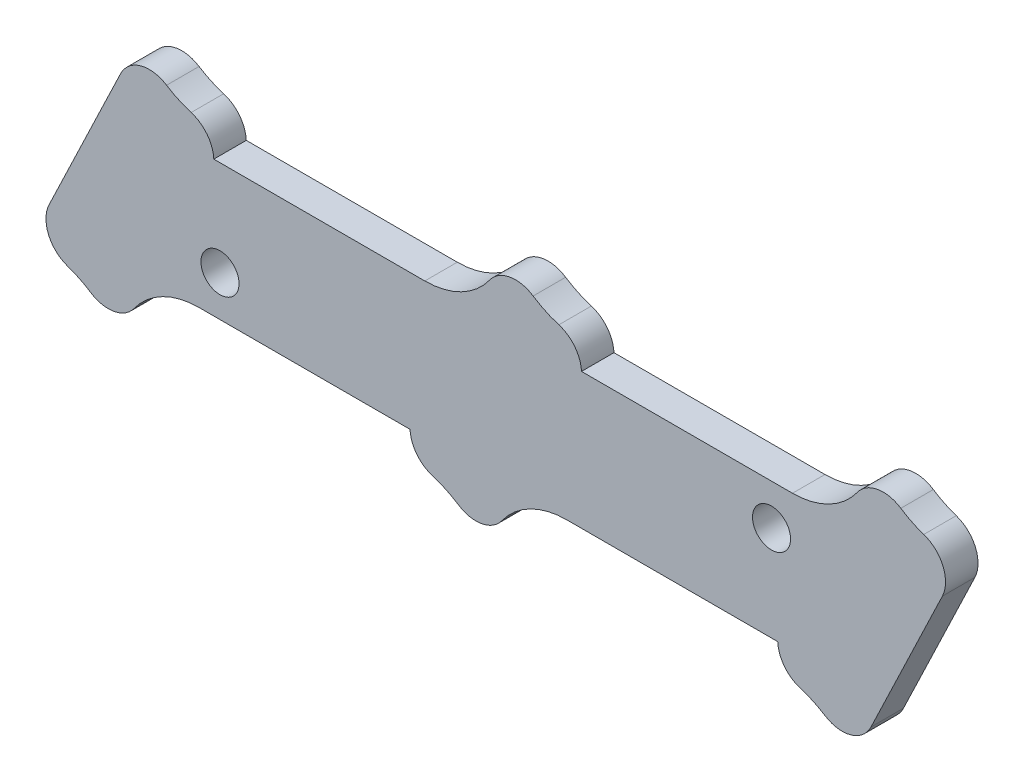
from build123d import *

# Parameters (mm, degrees)
BOSS_EXTRUDE1_DEPTH = 2.032
FILLET1_R           = 5
FILLET4_R           = 2
SKETCH5_R           = 1.190625
CUT_EXTRUDE1_DEPTH  = 75.011460165


with BuildPart() as part:
    # Sketch3 → Boss-Extrude1 (new body)
    with BuildSketch(Plane.XY):
        with BuildLine():
            Line((61.234837488, 27.025), (44.888079179, 27.025))
            Line((44.888079179, 27.025), (45.635822761, 28.585508346))
            ThreePointArc((45.635822761, 28.585508346), (42.595854881, 29.183740622), (40.224926589, 31.178229429))
            Line((40.224926589, 31.178229429), (38.234837488, 27.025))
            Line((38.234837488, 27.025), (21.888079179, 27.025))
            Line((21.888079179, 27.025), (22.635822761, 28.585508346))
            ThreePointArc((22.635822761, 28.585508346), (19.595854881, 29.183740622), (17.224926589, 31.178229429))
            Line((17.224926589, 31.178229429), (10.414177239, 16.964491654))
            ThreePointArc((10.414177239, 16.964491654), (13.454145119, 16.366259378), (15.825073411, 14.371770571))
            Line((15.825073411, 14.371770571), (17.815162512, 18.525))
            Line((17.815162512, 18.525), (34.161920821, 18.525))
            Line((34.161920821, 18.525), (33.414177239, 16.964491654))
            ThreePointArc((33.414177239, 16.964491654), (36.454145119, 16.366259378), (38.825073411, 14.371770571))
            Line((38.825073411, 14.371770571), (40.815162512, 18.525))
            Line((40.815162512, 18.525), (57.161920821, 18.525))
            Line((57.161920821, 18.525), (56.414177239, 16.964491654))
            ThreePointArc((56.414177239, 16.964491654), (59.454145119, 16.366259378), (61.825073411, 14.371770571))
            Line((61.825073411, 14.371770571), (68.635822761, 28.585508346))
            ThreePointArc((68.635822761, 28.585508346), (65.595854881, 29.183740622), (63.224926589, 31.178229429))
            Line((63.224926589, 31.178229429), (61.234837488, 27.025))
        make_face()
    extrude(amount=BOSS_EXTRUDE1_DEPTH)

    # Fillet1
    fillet1_edges = [part.edges().sort_by_distance(p)[0] for p in [
        (38.234837488, 27.025, 1.016),
        (61.234837488, 27.025, 1.016),
        (40.815162512, 18.525, 1.016),
        (17.815162512, 18.525, 1.016),
    ]]
    fillet(fillet1_edges, radius=FILLET1_R)

    # Fillet4
    # the kernel refuses this fillet: 2 mm, written as the material it takes off along each edge
    with BuildSketch(Plane(origin=(61.825073411, 14.371770571, -6.782329983), x_dir=(-0.7244869564055234, 0.6892885099856672, 0), z_dir=(0, 0, 1))) as fillet4_piece_1:
        with BuildLine():
            CenterArc((2.739483145, -1.963474497), FILLET4_R, 100.966900666, 97.004726409)
            Line((0.837064294, -2.580566482), (0.799015917, -2.592908322))
            Line((0.799015917, -2.592908322), (-0.038048377, -0.01234184))
            Line((-0.038048377, -0.01234184), (0.007609675, 0.03926949))
            ThreePointArc((0.007609675, 0.03926949), (1.179499687, -0.073229059), (2.351389699, 0.03926949))
            Line((2.351389699, 0.03926949), (2.358999374, 0))
        make_face()
    extrude(amount=15.596659966, mode=Mode.SUBTRACT)
    with BuildSketch(Plane(origin=(56.414177239, 16.964491654, -5.447751417), x_dir=(0.4321201804305817, 0.9018160287246183, 0), z_dir=(0, 0, 1)), Plane(origin=(33.414177239, 16.964491654, -5.447751417), x_dir=(0.4321201804305726, 0.9018160287246226, 0), z_dir=(0, 0, 1))) as fillet4_piece_2:
        with BuildLine():
            CenterArc((2.679877065, -1.760257284), FILLET4_R, 118.342114692, 70.353672363)
            Line((0.702867053, -2.062633556), (0.663326852, -2.068681081))
            ThreePointArc((0.663326852, -2.068681081), (0.404900733, -1.013097188), (-0.035005574, -0.019354839))
            Line((-0.035005574, -0.019354839), (0, 0.04))
            ThreePointArc((0, 0.04), (0.865203266, 0.04), (1.71141712, 0.035205146))
            Line((1.71141712, 0.035205146), (1.730406531, 0))
        make_face()
    extrude(amount=12.927502834, mode=Mode.SUBTRACT)
    with BuildSketch(Plane(origin=(68.635822761, 28.585508346, -6.782329983), x_dir=(-0.43212018043056016, -0.9018160287246285, 0), z_dir=(0, 0, 1))) as fillet4_piece_3:
        with BuildLine():
            CenterArc((2.712931993, -2), FILLET4_R, 90, 97.004726409)
            Line((0.727859803, -2.243902439), (0.688158359, -2.248780488))
            ThreePointArc((0.688158359, -2.248780488), (0.433586073, -1.099356687), (-0.035005574, -0.019354839))
            Line((-0.035005574, -0.019354839), (0, 0.04))
            Line((0, 0.04), (2.712931993, 0.04))
            Line((2.712931993, 0.04), (2.712931993, 0))
        make_face()
    extrude(amount=15.596659966, mode=Mode.SUBTRACT)
    with BuildSketch(Plane(origin=(63.224926589, 31.178229429, -5.862766834), x_dir=(0.7197655743666583, -0.6942171979695075, 0), z_dir=(0, 0, 1)), Plane(origin=(38.825073411, 14.371770571, -5.862766834), x_dir=(-0.7197655743666577, 0.6942171979695083, 0), z_dir=(0, 0, 1))) as fillet4_piece_4:
        with BuildLine():
            CenterArc((2.642931874, -1.966025629), FILLET4_R, 100.575844506, 87.569716535)
            Line((0.663109271, -2.249402518), (0.465127011, -2.277740206))
            ThreePointArc((0.465127011, -2.277740206), (0.269143449, -1.445696099), (-0.189816279, -0.063006193))
            Line((-0.189816279, -0.063006193), (0.036707387, 0.196602563))
            ThreePointArc((0.036707387, 0.196602563), (1.137929001, 0.094679449), (2.239150616, 0.196602563))
            Line((2.239150616, 0.196602563), (2.275858003, 0))
        make_face()
    extrude(amount=13.757533668, mode=Mode.SUBTRACT)
    with BuildSketch(Plane(origin=(45.635822761, 28.585508346, -5.447751417), x_dir=(-0.992996409987433, 0.11814452908226362, 0), z_dir=(0, 0, 1)), Plane(origin=(22.635822761, 28.585508346, -5.447751417), x_dir=(-0.9929964099874332, 0.11814452908226183, 0), z_dir=(0, 0, 1))) as fillet4_piece_5:
        with BuildLine():
            CenterArc((2.5305684, 1.968875405), FILLET4_R, 189.524957294, 70.353672363)
            Line((0.558141169, 1.637920999), (0.518692625, 1.631301911))
            ThreePointArc((0.518692625, 1.631301911), (0.241208476, 0.831862466), (-0.037862109, 0.012901966))
            Line((-0.037862109, 0.012901966), (0.007029357, -0.039377508))
            ThreePointArc((0.007029357, -0.039377508), (1.089550283, 0.056486243), (2.17207121, -0.039377508))
            Line((2.17207121, -0.039377508), (2.179100567, 0))
        make_face()
    extrude(amount=12.927502834, mode=Mode.SUBTRACT)
    with BuildSketch(Plane(origin=(40.224926589, 31.178229429, -5.862766834), x_dir=(-0.4623630437345738, -0.8866907103316808, 0), z_dir=(0, 0, 1)), Plane(origin=(15.825073411, 14.371770571, -5.862766834), x_dir=(0.46236304373457116, 0.886690710331682, 0), z_dir=(0, 0, 1))) as fillet4_piece_6:
        with BuildLine():
            CenterArc((2.633114962, 1.979154178), FILLET4_R, 174.150669546, 87.569716535)
            Line((0.643528297, 2.18297984), (0.44456963, 2.203362406))
            ThreePointArc((0.44456963, 2.203362406), (0.230948584, 1.118261759), (-0.178199689, 0.090801271))
            Line((-0.178199689, 0.090801271), (0.006761891, -0.199885659))
            ThreePointArc((0.006761891, -0.199885659), (1.462800781, -0.150629619), (2.316305911, -0.197915418))
            Line((2.316305911, -0.197915418), (2.345106734, 0))
        make_face()
    extrude(amount=13.757533668, mode=Mode.SUBTRACT)
    with BuildSketch(Plane(origin=(10.414177239, 16.964491654, -6.782329983), x_dir=(0.9911448562189062, -0.13278506689685937, 0), z_dir=(0, 0, 1))) as fillet4_piece_7:
        with BuildLine():
            CenterArc((2.739483145, 1.963474497), FILLET4_R, 162.028372925, 97.004726409)
            Line((0.837064294, 2.580566482), (0.799015917, 2.592908322))
            Line((0.799015917, 2.592908322), (-0.038048377, 0.01234184))
            Line((-0.038048377, 0.01234184), (0.007609675, -0.03926949))
            ThreePointArc((0.007609675, -0.03926949), (1.179499687, 0.073229059), (2.351389699, -0.03926949))
            Line((2.351389699, -0.03926949), (2.358999374, 0))
        make_face()
    extrude(amount=15.596659966, mode=Mode.SUBTRACT)
    with BuildSketch(Plane(origin=(17.224926589, 31.178229429, -6.782329983), x_dir=(-0.4321201804305535, -0.9018160287246317, 0), z_dir=(0, 0, 1))) as fillet4_piece_8:
        with BuildLine():
            CenterArc((2.712931993, 2), FILLET4_R, 172.995273591, 97.004726409)
            Line((0.727859803, 2.243902439), (0.688158359, 2.248780488))
            ThreePointArc((0.688158359, 2.248780488), (0.433586073, 1.099356687), (-0.035005574, 0.019354839))
            Line((-0.035005574, 0.019354839), (0, -0.04))
            Line((0, -0.04), (2.712931993, -0.04))
            Line((2.712931993, -0.04), (2.712931993, 0))
        make_face()
    extrude(amount=15.596659966, mode=Mode.SUBTRACT)

    # Sketch5 → Cut-Extrude1 (cut, through all)
    with BuildSketch(Plane.XY.offset(2.032)):
        with Locations((22.275, 21.065)):
            Circle(SKETCH5_R)
        with Locations((56.775, 24.485)):
            Circle(SKETCH5_R)
    extrude(amount=-CUT_EXTRUDE1_DEPTH, mode=Mode.SUBTRACT)


solid = part.part
